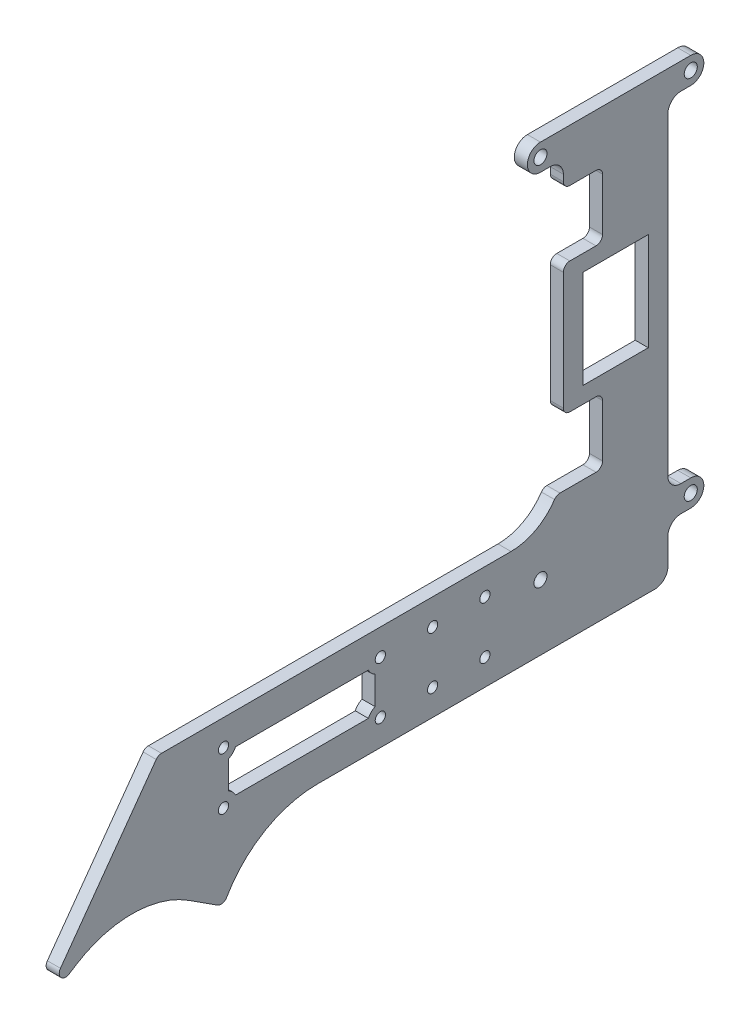
from build123d import *

# Parameters (mm, degrees)
SKETCH2_R           = 2.4892
SKETCH2_R_2         = 3.175
SKETCH2_R_3         = 6.35
BOSS_EXTRUDE1_DEPTH = 6.35
FILLET1_R           = 25.4
FILLET2_R           = 6.35
FILLET3_R           = 12.7
SKETCH3_W           = 19.05
SKETCH3_H           = 31.75
CUT_EXTRUDE1_DEPTH  = 410.639602463
FILLET4_R           = 3.175
BOSS_EXTRUDE2_START = -6.35
BOSS_EXTRUDE2_DEPTH = 6.35
FILLET5_R           = 50.8
FILLET6_R           = 3.1496
SKETCH5_W           = 31.75
SKETCH5_H           = 47.625
CUT_EXTRUDE2_DEPTH  = 410.639602463


with BuildPart() as part:
    # Sketch2 → Boss-Extrude1 (new body)
    # profile 1 of 8: a face of its own
    with BuildSketch(Plane(origin=(228.6, 0, 0), x_dir=(0, 0, -1), z_dir=(1, 0, 0))):
        Polygon((190.5, 152.4), (12.7, 152.4), (12.7, 101.6), (241.3, 101.6), (241.3, 127), (241.3, 139.7), (241.3, 152.4), align=None)
        with Locations((25.4, 114.3)):
            Circle(SKETCH2_R, mode=Mode.SUBTRACT)
        with Locations((25.4, 139.7)):
            Circle(SKETCH2_R, mode=Mode.SUBTRACT)
        with Locations((101.6, 114.3)):
            Circle(SKETCH2_R, mode=Mode.SUBTRACT)
        with Locations((127, 114.3)):
            Circle(SKETCH2_R, mode=Mode.SUBTRACT)
        with Locations((101.6, 139.7)):
            Circle(SKETCH2_R, mode=Mode.SUBTRACT)
        with Locations((127, 139.7)):
            Circle(SKETCH2_R, mode=Mode.SUBTRACT)
        with Locations((152.4, 114.3)):
            Circle(SKETCH2_R, mode=Mode.SUBTRACT)
        with Locations((152.4, 139.7)):
            Circle(SKETCH2_R, mode=Mode.SUBTRACT)
        with Locations((179.3875, 133.35)):
            Circle(SKETCH2_R_2, mode=Mode.SUBTRACT)
    # profile 2 of 8: a face of its own
    with BuildSketch(Plane(origin=(228.6, 0, 0), x_dir=(0, 0, -1), z_dir=(1, 0, 0))):
        Polygon((190.5, 304.8), (190.5, 152.4), (241.3, 152.4), (241.3, 304.8), (241.3, 317.5), (190.5, 317.5), align=None)
    # profile 3 of 8: a face of its own
    with BuildSketch(Plane(origin=(228.6, 0, 0), x_dir=(0, 0, -1), z_dir=(1, 0, 0))):
        with BuildLine():
            Line((179.3875, 304.8), (190.5, 304.8))
            Line((190.5, 304.8), (190.5, 317.5))
            Line((190.5, 317.5), (179.3875, 317.5))
            ThreePointArc((179.3875, 317.5), (183.877628061, 315.640128061), (185.7375, 311.15))
            ThreePointArc((185.7375, 311.15), (183.877628061, 306.659871939), (179.3875, 304.8))
        make_face()
    # profile 4 of 8: a face of its own
    with BuildSketch(Plane(origin=(228.6, 0, 0), x_dir=(0, 0, -1), z_dir=(1, 0, 0))):
        with Locations((179.3875, 311.15)):
            Circle(SKETCH2_R_3)
        with Locations((179.3875, 311.15)):
            Circle(SKETCH2_R_2, mode=Mode.SUBTRACT)
    # profile 5 of 8: a face of its own
    with BuildSketch(Plane(origin=(228.6, 0, 0), x_dir=(0, 0, -1), z_dir=(1, 0, 0))):
        with Locations((252.4125, 311.15)):
            Circle(SKETCH2_R_3)
        with Locations((252.4125, 311.15)):
            Circle(SKETCH2_R_2, mode=Mode.SUBTRACT)
    # profile 6 of 8: a face of its own
    with BuildSketch(Plane(origin=(228.6, 0, 0), x_dir=(0, 0, -1), z_dir=(1, 0, 0))):
        with BuildLine():
            Line((241.3, 317.5), (241.3, 304.8))
            Line((241.3, 304.8), (252.4125, 304.8))
            ThreePointArc((252.4125, 304.8), (246.0625, 311.15), (252.4125, 317.5))
            Line((252.4125, 317.5), (241.3, 317.5))
        make_face()
    # profile 7 of 8: a face of its own
    with BuildSketch(Plane(origin=(228.6, 0, 0), x_dir=(0, 0, -1), z_dir=(1, 0, 0))):
        with BuildLine():
            Line((252.4125, 139.7), (241.3, 139.7))
            Line((241.3, 139.7), (241.3, 127))
            Line((241.3, 127), (252.4125, 127))
            ThreePointArc((252.4125, 127), (246.0625, 133.35), (252.4125, 139.7))
        make_face()
    # profile 8 of 8: a face of its own
    with BuildSketch(Plane(origin=(228.6, 0, 0), x_dir=(0, 0, -1), z_dir=(1, 0, 0))):
        with Locations((252.4125, 133.35)):
            Circle(SKETCH2_R_3)
        with Locations((252.4125, 133.35)):
            Circle(SKETCH2_R_2, mode=Mode.SUBTRACT)
    extrude(amount=-BOSS_EXTRUDE1_DEPTH)

    # Fillet1
    fillet1_edges = [part.edges().sort_by_distance(p)[0] for p in [
        (225.425, 152.4, -190.5),
    ]]
    fillet(fillet1_edges, radius=FILLET1_R)

    # Fillet2
    fillet2_edges = [part.edges().sort_by_distance(p)[0] for p in [
        (225.425, 139.7, -241.3),
        (225.425, 127, -241.3),
        (225.425, 101.6, -241.3),
        (225.425, 304.8, -190.5),
        (225.425, 304.8, -241.3),
    ]]
    fillet(fillet2_edges, radius=FILLET2_R)

    # Fillet3
    fillet3_edges = [part.edges().sort_by_distance(p)[0] for p in [
        (225.425, 101.6, -12.7),
        (225.425, 152.4, -12.7),
    ]]
    fillet(fillet3_edges, radius=FILLET3_R)

    # Sketch3 → Cut-Extrude1 (cut, through all)
    with BuildSketch(Plane(origin=(228.6, 0, 0), x_dir=(0, 0, -1), z_dir=(1, 0, 0))):
        with BuildLine():
            Line((190.5, 177.8), (190.5, 190.18276047))
            Line((190.5, 190.18276047), (98.023677914, 190.18276047))
            Line((98.023677914, 190.18276047), (98.023677914, 165.1))
            Line((98.023677914, 165.1), (187.097045256, 165.1))
            ThreePointArc((187.097045256, 165.1), (189.634515988, 171.225996254), (190.5, 177.8))
        make_face()
        with Locations((200.025, 276.225)):
            Rectangle(SKETCH3_W, SKETCH3_H)
        with BuildLine():
            Line((190.5, 165.1), (190.5, 177.8))
            ThreePointArc((190.5, 177.8), (189.634515988, 171.225996254), (187.097045256, 165.1))
            Line((187.097045256, 165.1), (190.5, 165.1))
        make_face()
        Polygon((209.55, 196.85), (190.5, 196.85), (190.5, 190.18276047), (190.5, 177.8), (190.5, 165.1), (209.55, 165.1), align=None)
    extrude(amount=-CUT_EXTRUDE1_DEPTH, mode=Mode.SUBTRACT)

    # Fillet4
    fillet4_edges = [part.edges().sort_by_distance(p)[0] for p in [
        (225.425, 165.1, -187.097045256),
        (225.425, 292.1, -190.5),
        (225.425, 292.1, -209.55),
        (225.425, 260.35, -209.55),
        (225.425, 260.35, -190.5),
        (225.425, 165.1, -209.55),
        (225.425, 196.85, -190.5),
        (225.425, 196.85, -209.55),
    ]]
    fillet(fillet4_edges, radius=FILLET4_R)

    # Sketch4 → Boss-Extrude2 (add)
    with BuildSketch(Plane(origin=(228.6, 0, 0), x_dir=(0, 0, -1), z_dir=(1, 0, 0)).offset(BOSS_EXTRUDE2_START)):
        with BuildLine():
            Line((-6.35, 152.4), (-63.5, 73.025))
            Line((-63.5, 73.025), (-19.05, 101.6))
            Line((-19.05, 101.6), (25.4, 73.025))
            Line((25.4, 73.025), (25.4, 101.6))
            ThreePointArc((25.4, 101.6), (16.419743879, 105.319743879), (12.7, 114.3))
            Line((12.7, 114.3), (12.7, 139.7))
            ThreePointArc((12.7, 139.7), (16.419743879, 148.680256121), (25.4, 152.4))
            Line((25.4, 152.4), (-6.35, 152.4))
        make_face()
    extrude(amount=BOSS_EXTRUDE2_DEPTH)

    # Fillet5
    # the kernel refuses this fillet: 50.8 mm, written as the material it adds along each edge
    with BuildSketch(Plane(origin=(222.25, 101.6, 19.05), x_dir=(0, -0.5407575913134988, -0.8411784753765537), z_dir=(1, 0, 0))) as fillet5_piece_1:
        with BuildLine():
            CenterArc((FILLET5_R * 0.642857142857, -FILLET5_R), FILLET5_R, 90, 65.470452544)
            Line((-FILLET5_R * 0.266890149562, -FILLET5_R * 0.584837545126), (-FILLET5_R * 0.28508509541, -FILLET5_R * 0.576534296029))
            Line((-FILLET5_R * 0.28508509541, -FILLET5_R * 0.576534296029), (-FILLET5_R * 0.0128571428571, FILLET5_R * 0.02))
            Line((-FILLET5_R * 0.0128571428571, FILLET5_R * 0.02), (FILLET5_R * 0.642857142857, FILLET5_R * 0.02))
            Line((FILLET5_R * 0.642857142857, FILLET5_R * 0.02), (FILLET5_R * 0.642857142857, 0))
        make_face()
    extrude(amount=6.35)
    with BuildSketch(Plane(origin=(228.6, 101.6, -25.4), x_dir=(0, 0, -1), z_dir=(-1, 0, 0))) as fillet5_piece_2_section:
        with BuildLine():
            CenterArc((45.68029526, 50.8), FILLET5_R, 205.944479772, 64.055520228)
            Line((0, 28.575), (-0.913605905, 28.1305))
            ThreePointArc((-0.913605905, 28.1305), (-1.016, 14.2875), (-1.016, 0))
            Line((-1.016, 0), (0, -1.016))
            Line((0, -1.016), (45.68029526, -1.016))
            Line((45.68029526, -1.016), (45.68029526, 0))
        make_face()
    fillet5_piece_2 = extrude(amount=6.35, mode=Mode.PRIVATE)
    fillet5_piece_2 = split(fillet5_piece_2, bisect_by=Plane(origin=(225.425, 74.109510014, -23.712984423), z_dir=(0, 0.8411784753765535, -0.5407575913134988)), keep=Keep.TOP, mode=Mode.PRIVATE)
    add(fillet5_piece_2)

    # Fillet6
    fillet6_edges = [part.edges().sort_by_distance(p)[0] for p in [
        (225.425, 73.025, -25.4),
        (225.425, 73.025, 63.5),
        (225.425, 152.4, 6.35),
    ]]
    fillet(fillet6_edges, radius=FILLET6_R)

    # Sketch5 → Cut-Extrude2 (cut, through all)
    with BuildSketch(Plane(origin=(228.6, 0, 0), x_dir=(0, 0, -1), z_dir=(1, 0, 0))):
        with Locations((215.9, 228.6)):
            Rectangle(SKETCH5_W, SKETCH5_H)
        with BuildLine():
            ThreePointArc((99.06, 133.880128867), (97.109871939, 135.209871939), (95.780128867, 137.16))
            Line((95.780128867, 137.16), (31.219871133, 137.16))
            ThreePointArc((31.219871133, 137.16), (29.890128061, 135.209871939), (27.94, 133.880128867))
            Line((27.94, 133.880128867), (27.94, 120.119871133))
            ThreePointArc((27.94, 120.119871133), (29.890128061, 118.790128061), (31.219871133, 116.84))
            Line((31.219871133, 116.84), (95.780128867, 116.84))
            ThreePointArc((95.780128867, 116.84), (97.109871939, 118.790128061), (99.06, 120.119871133))
            Line((99.06, 120.119871133), (99.06, 133.880128867))
        make_face()
    extrude(amount=-CUT_EXTRUDE2_DEPTH, mode=Mode.SUBTRACT)


solid = part.part
